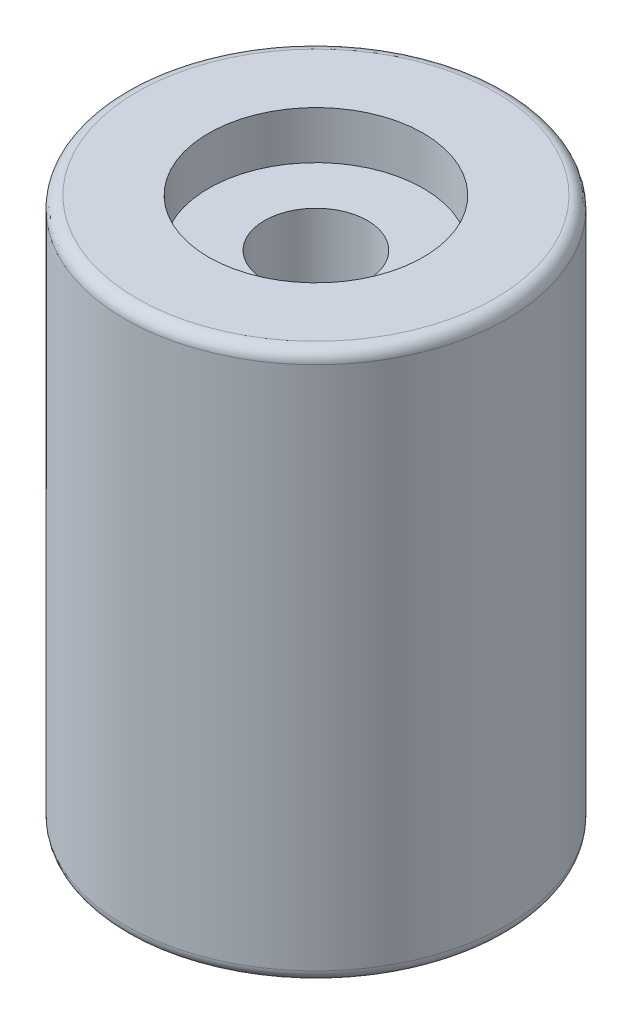
from build123d import *

# Parameters (mm, degrees)
SKETCH1_R               = 25.4
BOSS_EXTRUDE1_DEPTH     = 73.025
FILLET1_R               = 1.5875
SKETCH2_R               = 14.2875
CUT_EXTRUDE1_DEPTH      = 6.35
CUT_EXTRUDE2_START      = -6.35
SKETCH3_R               = 14.2875
CUT_EXTRUDE2_DEPTH      = 6.35
CUT_EXTRUDE3_DEPTH      = 76.735563839
CUT_EXTRUDE3_DEPTH_BACK = 76.735563839
SKETCH4_R               = 6.858


with BuildPart() as part:
    # Sketch1 → Boss-Extrude1 (new body)
    with BuildSketch(Plane(origin=(0, 0, 0), x_dir=(1, 0, 0), z_dir=(0, 1, 0))):
        Circle(SKETCH1_R)
    extrude(amount=BOSS_EXTRUDE1_DEPTH)

    # Fillet1
    fillet1_edges = [part.edges().sort_by_distance(p)[0] for p in [
        (-25.4, 0, 0),
        (-25.4, 73.025, 0),
    ]]
    fillet(fillet1_edges, radius=FILLET1_R)

    # Sketch2 → Cut-Extrude1 (cut)
    with BuildSketch(Plane(origin=(0, 73.025, 0), x_dir=(1, 0, 0), z_dir=(0, 1, 0))):
        Circle(SKETCH2_R)
    extrude(amount=-CUT_EXTRUDE1_DEPTH, mode=Mode.SUBTRACT)

    # Sketch3 → Cut-Extrude2 (cut)
    with BuildSketch(Plane.XZ.offset(CUT_EXTRUDE2_START)):
        Circle(SKETCH3_R)
    extrude(amount=CUT_EXTRUDE2_DEPTH, mode=Mode.SUBTRACT)

    # Sketch4 → Cut-Extrude3 (cut, two sides: drawn at the far end of the back side and taken through both)
    with BuildSketch(Plane.XZ.offset(-6.35).offset(-CUT_EXTRUDE3_DEPTH_BACK)):
        Circle(SKETCH4_R)
    extrude(amount=CUT_EXTRUDE3_DEPTH + CUT_EXTRUDE3_DEPTH_BACK, mode=Mode.SUBTRACT)


solid = part.part
